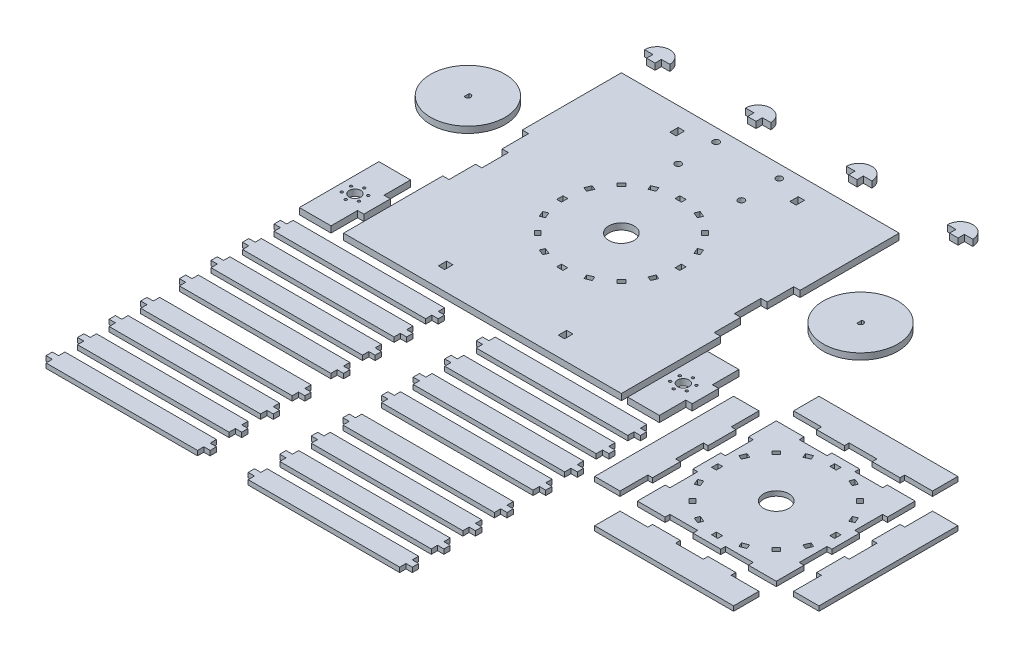
from build123d import *

# Parameters (mm, degrees)
SKETCH1_W              = 279.4
SKETCH1_H              = 279.4
BOSS_EXTRUDE1_DEPTH    = 6.35
SKETCH2_W              = 6.35
SKETCH2_H              = 80.00000002
CUT_EXTRUDE1_DEPTH     = 396.182290216
SKETCH3_R              = 37.5
BOSS_EXTRUDE2_DEPTH    = 6.35
SKETCH4_R              = 2.794
CUT_EXTRUDE3_DEPTH     = 6.35
SKETCH5_W              = 10
SKETCH5_H              = 10
BOSS_EXTRUDE4_DEPTH    = 6.35
BODY_MOVE_COPY1_ANGLE  = 90
SKETCH9_W              = 6.35
SKETCH9_H              = 80.00000002
BOSS_EXTRUDE5_DEPTH    = 31.841868752
SKETCH9_H_2            = 80
BOSS_EXTRUDE5_2_DEPTH  = 31.841868752
SKETCH10_R             = 5.842
CUT_EXTRUDE4_DEPTH     = 6.35
SKETCH11_R             = 1.27
CUT_EXTRUDE5_DEPTH     = 6.35
CIRPATTERN1_COUNT      = 6
SKETCH12_R             = 5.842
CUT_EXTRUDE6_DEPTH     = 6.35
SKETCH13_R             = 1.27
CUT_EXTRUDE7_DEPTH     = 6.35
CIRPATTERN2_COUNT      = 6
SKETCH14_W             = 6.35
SKETCH14_H             = 26.666666674
BOSS_EXTRUDE6_DEPTH    = 6.35
SKETCH15_W             = 6.35
SKETCH15_H             = 26.666666666
BOSS_EXTRUDE7_DEPTH    = 6.35
SKETCH18_W             = 26.666666674
SKETCH18_H             = 6.35
CUT_EXTRUDE8_DEPTH     = 6.35
SKETCH19_W             = 26.666666674
SKETCH19_H             = 6.35
CUT_EXTRUDE9_DEPTH     = 6.35
BODY_MOVE_COPY12_ANGLE = 90
BODY_MOVE_COPY13_ANGLE = 90
SKETCH23_R             = 3.175
CUT_EXTRUDE12_DEPTH    = 6.35
SKETCH24_R             = 12.7
BOSS_EXTRUDE11_DEPTH   = 6.35
SKETCH25_W             = 57.15
SKETCH25_H             = 55.515068024
CUT_EXTRUDE13_DEPTH    = 467.924067709
SKETCH26_W             = 8.466666667
SKETCH26_H             = 6.35
BOSS_EXTRUDE12_DEPTH   = 6.35
SKETCH27_W             = 6.35
SKETCH27_H             = 8.382
CUT_EXTRUDE14_DEPTH    = 467.924067709
SKETCH28_R             = 12.7
SKETCH28_W             = 6.35
SKETCH28_H             = 4.7625
CUT_EXTRUDE15_DEPTH    = 467.924067709
CIRPATTERN3_COUNT      = 16
SKETCH29_W             = 165.1
SKETCH29_H             = 19.05
BOSS_EXTRUDE14_DEPTH   = 4.7625
SKETCH30_W             = 6.35
SKETCH30_H             = 4.7625
CUT_EXTRUDE16_DEPTH    = 6.35
SKETCH31_W             = 6.35
SKETCH31_H             = 4.7625
CUT_EXTRUDE17_DEPTH    = 6.35
SKETCH32_W             = 139.7
SKETCH32_H             = 139.7
BOSS_EXTRUDE15_DEPTH   = 4.7625
SKETCH33_R             = 12.7
SKETCH33_W             = 6.35
SKETCH33_H             = 4.7625
CUT_EXTRUDE18_DEPTH    = 553.355903322
CIRPATTERN4_COUNT      = 16
SKETCH35_W             = 27.94
SKETCH35_H             = 4.7625
CUT_EXTRUDE19_DEPTH    = 4.7625
CIRPATTERN5_COUNT      = 4
SKETCH37_W             = 139.7
SKETCH37_H             = 30.226
BOSS_EXTRUDE16_DEPTH   = 4.7625
SKETCH38_W             = 27.94
SKETCH38_H             = 4.7625
CUT_EXTRUDE20_DEPTH    = 4.7625
CIRPATTERN8_COUNT      = 4


with BuildPart() as part:
    # Sketch1 → Boss-Extrude1 (new body)
    with BuildSketch(Plane(origin=(0, 0, 0), x_dir=(1, 0, 0), z_dir=(0, 1, 0))):
        with Locations((-139.7, -139.7)):
            Rectangle(SKETCH1_W, SKETCH1_H)
    extrude(amount=BOSS_EXTRUDE1_DEPTH)

    # Sketch2 → Cut-Extrude1 (cut, through all)
    with BuildSketch(Plane(origin=(0, 6.35, 0), x_dir=(1, 0, 0), z_dir=(0, 1, 0))):
        with Locations((-276.225, -139.7)):
            Rectangle(SKETCH2_W, SKETCH2_H)
        with Locations((-3.175, -139.7)):
            Rectangle(SKETCH2_W, SKETCH2_H)
    extrude(amount=-CUT_EXTRUDE1_DEPTH, mode=Mode.SUBTRACT)

    # Sketch18 → Cut-Extrude8 (cut)
    with BuildSketch(Plane(origin=(-6.35, 0, 0), x_dir=(0, 0, -1), z_dir=(1, 0, 0))):
        with Locations((-139.7, 3.175)):
            Rectangle(SKETCH18_W, SKETCH18_H)
    extrude(amount=-CUT_EXTRUDE8_DEPTH, mode=Mode.SUBTRACT)

    # Sketch19 → Cut-Extrude9 (cut)
    with BuildSketch(Plane.ZY.offset(273.05)):
        with Locations((139.7, 3.175)):
            Rectangle(SKETCH19_W, SKETCH19_H)
    extrude(amount=-CUT_EXTRUDE9_DEPTH, mode=Mode.SUBTRACT)

    # Sketch23 → Cut-Extrude12 (cut)
    with BuildSketch(Plane(origin=(0, 6.35, 0), x_dir=(1, 0, 0), z_dir=(0, 1, 0))):
        with Locations(Location((-171.45, -12.7, 0), (0, 0, 270))):
            Circle(SKETCH23_R)
        with Locations(Location((-171.45, -50.8, 0), (0, 0, 270))):
            Circle(SKETCH23_R)
        with Locations(Location((-107.95, -50.8, 0), (0, 0, 270))):
            Circle(SKETCH23_R)
        with Locations(Location((-107.95, -12.7, 0), (0, 0, 270))):
            Circle(SKETCH23_R)
    extrude(amount=-CUT_EXTRUDE12_DEPTH, mode=Mode.SUBTRACT)

    # Sketch27 → Cut-Extrude14 (cut, through all)
    with BuildSketch(Plane(origin=(0, 6.35, 0), x_dir=(1, 0, 0), z_dir=(0, 1, 0))):
        with Locations((-200.025, -23.241)):
            Rectangle(SKETCH27_W, SKETCH27_H)
        with Locations((-79.375, -23.241)):
            Rectangle(SKETCH27_W, SKETCH27_H)
        with Locations((-79.375, -256.159)):
            Rectangle(SKETCH27_W, SKETCH27_H)
        with Locations((-200.025, -256.159)):
            Rectangle(SKETCH27_W, SKETCH27_H)
    extrude(amount=-CUT_EXTRUDE14_DEPTH, mode=Mode.SUBTRACT)

    # Sketch28 → Cut-Extrude15 (cut, through all)
    with BuildSketch(Plane(origin=(0, 6.35, 0), x_dir=(1, 0, 0), z_dir=(0, 1, 0))):
        with Locations(Location((-139.7, -139.7, 0), (0, 0, 270))):
            Circle(SKETCH28_R)
        with Locations((-139.7, -199.23125)):
            Rectangle(SKETCH28_W, SKETCH28_H)
    cut_extrude15 = extrude(amount=-CUT_EXTRUDE15_DEPTH, mode=Mode.SUBTRACT)

    # CirPattern3: Cut-Extrude15 ×16 about axis
    cirpattern3_axis = Axis((-139.7, 0, 139.7), (0, 1, 0))
    for i in range(1, CIRPATTERN3_COUNT):
        add(cut_extrude15.rotate(cirpattern3_axis, i * 360 / CIRPATTERN3_COUNT), mode=Mode.SUBTRACT)


with BuildPart() as body_2:
    # Sketch3 → Boss-Extrude2 (new body)
    with BuildSketch(Plane(origin=(0, 0, 0), x_dir=(0, 0, -1), z_dir=(1, 0, 0))):
        with Locations((-97.251276482, 275.771880831)):
            Circle(SKETCH3_R)
    extrude(amount=BOSS_EXTRUDE2_DEPTH)

    # Sketch4 → Cut-Extrude3 (cut)
    with BuildSketch(Plane(origin=(6.35, 0, 0), x_dir=(0, 0, -1), z_dir=(1, 0, 0))):
        with Locations((-97.251276482, 275.771880831)):
            Circle(SKETCH4_R)
    extrude(amount=-CUT_EXTRUDE3_DEPTH, mode=Mode.SUBTRACT)

    # Sketch5 → Boss-Extrude4 (add)
    with BuildSketch(Plane(origin=(6.35, 0, 0), x_dir=(0, 0, -1), z_dir=(1, 0, 0))):
        with Locations((-99.898635716, 269.501880831)):
            Rectangle(SKETCH5_W, SKETCH5_H)
    extrude(amount=-BOSS_EXTRUDE4_DEPTH)


with BuildPart() as body_2_1:
    # Body-Move/Copy1: moved
    add(body_2.part.rotate(Axis((3.81, 275.771880831, 0), (0, 0, -1)), BODY_MOVE_COPY1_ANGLE))


with BuildPart() as body_2_2:
    # Body-Move/Copy3: read off the stored shape, not the designer's step
    # Body-Move/Copy3: moved
    add(body_2_1.part.moved(Location((54.61, -273.2318808, 0))))


with BuildPart() as body_3:
    # Body-Move/Copy4: copy of body 2
    add(body_2_2.part.moved(Location((-430, 0, 0))))


with BuildPart() as body_3_1:
    # Body-Move/Copy7: read off the stored shape, not the designer's step
    # Body-Move/Copy7: moved
    add(body_3.part.moved(Location((35.03, 0, 0))))


with BuildPart() as body_4:
    # Sketch9 → Boss-Extrude5 (new body)
    with BuildSketch(Plane(origin=(0, 6.35, 0), x_dir=(1, 0, 0), z_dir=(0, 1, 0))):
        with Locations((-269.875, -139.7)):
            Rectangle(SKETCH9_W, SKETCH9_H)
    extrude(amount=BOSS_EXTRUDE5_DEPTH)

    # Sketch10 → Cut-Extrude4 (cut)
    with BuildSketch(Plane.ZY.offset(273.05)):
        with Locations((139.7, 22.270934376)):
            Circle(SKETCH10_R)
    extrude(amount=-CUT_EXTRUDE4_DEPTH, mode=Mode.SUBTRACT)

    # Sketch11 → Cut-Extrude5 (cut)
    with BuildSketch(Plane.ZY.offset(273.05)):
        with Locations((130.05250812, 22.565899486)):
            Circle(SKETCH11_R)
    cut_extrude5 = extrude(amount=-CUT_EXTRUDE5_DEPTH, mode=Mode.SUBTRACT)

    # CirPattern1: Cut-Extrude5 ×6 about axis
    cirpattern1_axis = Axis((0, 22.270934376, 139.7), (1, 0, 0))
    for i in range(1, CIRPATTERN1_COUNT):
        add(cut_extrude5.rotate(cirpattern1_axis, i * 360 / CIRPATTERN1_COUNT), mode=Mode.SUBTRACT)


with BuildPart() as body_5:
    # Sketch9 → Boss-Extrude5 2 (new body)
    with BuildSketch(Plane(origin=(0, 6.35, 0), x_dir=(1, 0, 0), z_dir=(0, 1, 0))):
        with Locations((-9.525, -139.70000001)):
            Rectangle(SKETCH9_W, SKETCH9_H_2)
    extrude(amount=BOSS_EXTRUDE5_2_DEPTH)

    # Sketch12 → Cut-Extrude6 (cut)
    with BuildSketch(Plane(origin=(-6.35, 0, 0), x_dir=(0, 0, -1), z_dir=(1, 0, 0))):
        with Locations((-139.70000002, 22.270934376)):
            Circle(SKETCH12_R)
    extrude(amount=-CUT_EXTRUDE6_DEPTH, mode=Mode.SUBTRACT)

    # Sketch13 → Cut-Extrude7 (cut)
    with BuildSketch(Plane(origin=(-6.35, 0, 0), x_dir=(0, 0, -1), z_dir=(1, 0, 0))):
        with Locations((-149.35200002, 22.270934376)):
            Circle(SKETCH13_R)
    cut_extrude7 = extrude(amount=-CUT_EXTRUDE7_DEPTH, mode=Mode.SUBTRACT)

    # CirPattern2: Cut-Extrude7 ×6 about axis
    cirpattern2_axis = Axis((0, 22.270934376, 139.70000002), (1, 0, 0))
    for i in range(1, CIRPATTERN2_COUNT):
        add(cut_extrude7.rotate(cirpattern2_axis, i * 360 / CIRPATTERN2_COUNT), mode=Mode.SUBTRACT)


with BuildPart() as body_4_1:
    # Body-Move/Copy10: moved
    add(body_4.part.moved(Location((0, 50.8, 0))))

    # Sketch14 → Boss-Extrude6 (add)
    with BuildSketch(Plane(origin=(0, 57.15, 0), x_dir=(-1, 0, 0), z_dir=(0, -1, 0))):
        with Locations((269.875, -139.7)):
            Rectangle(SKETCH14_W, SKETCH14_H)
    extrude(amount=BOSS_EXTRUDE6_DEPTH)


with BuildPart() as body_5_1:
    # Body-Move/Copy10: moved
    add(body_5.part.moved(Location((0, 50.8, 0))))

    # Sketch15 → Boss-Extrude7 (add)
    with BuildSketch(Plane(origin=(0, 57.15, 0), x_dir=(-1, 0, 0), z_dir=(0, -1, 0))):
        with Locations((9.525, -139.70000001)):
            Rectangle(SKETCH15_W, SKETCH15_H)
    extrude(amount=BOSS_EXTRUDE7_DEPTH)


with BuildPart() as body_4_2:
    # Body-Move/Copy12: read off the stored shape, not the designer's step
    # Body-Move/Copy12: moved
    add(body_4_1.part.moved(Location((273.05, 234.95, 99.7))).rotate(Axis((0, 0, 0), (0, 0, 1)), BODY_MOVE_COPY12_ANGLE))


with BuildPart() as body_5_2:
    # Body-Move/Copy13: read off the stored shape, not the designer's step
    # Body-Move/Copy13: moved
    add(body_5_1.part.moved(Location((12.7, -95.3418688, 99.7))).rotate(Axis((0, 0, 0), (0, 0, 1)), BODY_MOVE_COPY13_ANGLE))


with BuildPart() as body_6:
    # Sketch24 → Boss-Extrude11 (new body)
    with BuildSketch(Plane(origin=(0, 0, 0), x_dir=(1, 0, 0), z_dir=(0, 1, 0))):
        with Locations(Location((-330.442968795, 66.703609718, 0), (0, 0, 270))):
            Circle(SKETCH24_R)
    extrude(amount=BOSS_EXTRUDE11_DEPTH)

    # Sketch25 → Cut-Extrude13 (cut, through all)
    with BuildSketch(Plane(origin=(0, 6.35, 0), x_dir=(1, 0, 0), z_dir=(0, 1, 0))):
        with Locations((-346.317968795, 38.946075706)):
            Rectangle(SKETCH25_W, SKETCH25_H)
    extrude(amount=-CUT_EXTRUDE13_DEPTH, mode=Mode.SUBTRACT)

    # Sketch26 → Boss-Extrude12 (add)
    with BuildSketch(Plane.XY.offset(-66.703609718)):
        with Locations((-330.442968795, 3.175)):
            Rectangle(SKETCH26_W, SKETCH26_H)
    extrude(amount=BOSS_EXTRUDE12_DEPTH)


with BuildPart() as body_6_1:
    # Body-Move/Copy14: read off the stored shape, not the designer's step
    # Body-Move/Copy14: moved
    add(body_6.part.moved(Location((55.2763021, 0, 34.9536097))))


with BuildPart() as body_7:
    # Body-Move/Copy15: copy of body 6
    add(body_6_1.part.moved(Location((101.6, 0, 0))))


with BuildPart() as body_8:
    # Body-Move/Copy16: copy of body 7
    add(body_7.part.moved(Location((101.6, 0, 0))))


with BuildPart() as body_9:
    # Body-Move/Copy17: copy of body 8
    add(body_8.part.moved(Location((101.6, 0, 0))))


with BuildPart() as body_10:
    # Sketch29 → Boss-Extrude14 (new body)
    with BuildSketch(Plane(origin=(0, 0, 0), x_dir=(1, 0, 0), z_dir=(0, 1, 0))):
        with Locations((-163.268990804, -364.473844535)):
            Rectangle(SKETCH29_W, SKETCH29_H)
    extrude(amount=BOSS_EXTRUDE14_DEPTH)

    # Sketch30 → Cut-Extrude16 (cut)
    with BuildSketch(Plane(origin=(-80.718990804, 0, 0), x_dir=(0, 0, -1), z_dir=(1, 0, 0))):
        with Locations((-370.823844535, 2.38125)):
            Rectangle(SKETCH30_W, SKETCH30_H)
        with Locations((-358.123844535, 2.38125)):
            Rectangle(SKETCH30_W, SKETCH30_H)
    extrude(amount=-CUT_EXTRUDE16_DEPTH, mode=Mode.SUBTRACT)

    # Sketch31 → Cut-Extrude17 (cut)
    with BuildSketch(Plane.ZY.offset(245.818990804)):
        with Locations((370.823844535, 2.38125)):
            Rectangle(SKETCH31_W, SKETCH31_H)
        with Locations((358.123844535, 2.38125)):
            Rectangle(SKETCH31_W, SKETCH31_H)
    extrude(amount=-CUT_EXTRUDE17_DEPTH, mode=Mode.SUBTRACT)


with BuildPart() as body_10_1:
    # Body-Move/Copy18: read off the stored shape, not the designer's step
    # Body-Move/Copy18: moved
    add(body_10.part.moved(Location((125.2608596, 0, -62.8488445))))


with BuildPart() as body_11:
    # Body-Move/Copy19: copy of body 10
    add(body_10_1.part.moved(Location((-182.495401927, 0, 0))))


with BuildPart() as body_11_1:
    # Body-Move/Copy20: read off the stored shape, not the designer's step
    # Body-Move/Copy20: moved
    add(body_11.part.moved(Location((-20.8883356, 0, 0))))


with BuildPart() as body_12:
    # Body-Move/Copy21: read off the stored shape, not the designer's step
    # Body-Move/Copy21: copy of body 11
    add(body_11_1.part.moved(Location((0, 0, 75.6060235))))


with BuildPart() as body_13:
    # Body-Move_Copy21 2: copy of body 11
    add(body_11_1.part.moved(Location((203.3837375, 0, 75.6060235))))


with BuildPart() as body_13_1:
    # Body-Move/Copy22: read off the stored shape, not the designer's step
    # Body-Move/Copy22: moved
    add(body_13.part.moved(Location((0, 0, -43.8560235))))


with BuildPart() as body_12_1:
    # Body-Move/Copy23: read off the stored shape, not the designer's step
    # Body-Move/Copy23: moved
    add(body_12.part.moved(Location((0, 0, -43.8560235))))


with BuildPart() as body_14:
    # Body-Move/Copy24: read off the stored shape, not the designer's step
    # Body-Move/Copy24: copy of body 12
    add(body_12_1.part.moved(Location((0, 0, 73.9515316))))


with BuildPart() as body_15:
    # Body-Move_Copy24 2: copy of body 12
    add(body_12_1.part.moved(Location((0, 0, 105.7015316))))


with BuildPart() as body_16:
    # Body-Move_Copy24 3: copy of body 12
    add(body_12_1.part.moved(Location((203.3837375, 0, 105.7015316))))


with BuildPart() as body_17:
    # Body-Move_Copy24 4: copy of body 12
    add(body_12_1.part.moved(Location((203.3837375, 0, 73.9515316))))


with BuildPart() as body_14_1:
    # Body-Move/Copy25: read off the stored shape, not the designer's step
    # Body-Move/Copy25: moved
    add(body_14.part.moved(Location((0, 0, -42.2015316))))


with BuildPart() as body_17_1:
    # Body-Move_Copy25 2: moved
    add(body_17.part.moved(Location((0, 0, -42.2015316))))


with BuildPart() as body_15_1:
    # Body-Move/Copy26: read off the stored shape, not the designer's step
    # Body-Move/Copy26: moved
    add(body_15.part.moved(Location((0, 0, -42.2015316))))


with BuildPart() as body_16_1:
    # Body-Move_Copy26 2: moved
    add(body_16.part.moved(Location((0, 0, -42.2015316))))


with BuildPart() as body_18:
    # Sketch32 → Boss-Extrude15 (new body)
    with BuildSketch(Plane(origin=(0, 0, 0), x_dir=(1, 0, 0), z_dir=(0, 1, 0))):
        with Locations((206.821592054, -219.287970599)):
            Rectangle(SKETCH32_W, SKETCH32_H)
    extrude(amount=BOSS_EXTRUDE15_DEPTH)

    # Sketch33 → Cut-Extrude18 (cut, through all)
    with BuildSketch(Plane(origin=(0, 4.7625, 0), x_dir=(1, 0, 0), z_dir=(0, 1, 0))):
        with Locations(Location((206.821592054, -219.287970599, 0), (0, 0, 270))):
            Circle(SKETCH33_R)
        with Locations((206.821592054, -278.819220599)):
            Rectangle(SKETCH33_W, SKETCH33_H)
    cut_extrude18 = extrude(amount=-CUT_EXTRUDE18_DEPTH, mode=Mode.SUBTRACT)

    # CirPattern4: Cut-Extrude18 ×16 about axis
    cirpattern4_axis = Axis((206.821592054, 0, 219.287970599), (0, 1, 0))
    for i in range(1, CIRPATTERN4_COUNT):
        add(cut_extrude18.rotate(cirpattern4_axis, i * 360 / CIRPATTERN4_COUNT), mode=Mode.SUBTRACT)

    # Sketch35 → Cut-Extrude19 (cut)
    with BuildSketch(Plane(origin=(276.671592054, 0, 0), x_dir=(0, 0, -1), z_dir=(1, 0, 0))):
        with Locations((-191.347970599, 2.38125)):
            Rectangle(SKETCH35_W, SKETCH35_H)
        with Locations((-247.227970599, 2.38125)):
            Rectangle(SKETCH35_W, SKETCH35_H)
    cut_extrude19 = extrude(amount=-CUT_EXTRUDE19_DEPTH, mode=Mode.SUBTRACT)

    # CirPattern5: Cut-Extrude19 ×4 about axis
    cirpattern5_axis = Axis((206.821592054, 0, 219.287970599), (0, 1, 0))
    for i in range(1, CIRPATTERN5_COUNT):
        add(cut_extrude19.rotate(cirpattern5_axis, i * 360 / CIRPATTERN5_COUNT), mode=Mode.SUBTRACT)


with BuildPart() as body_19:
    # Sketch37 → Boss-Extrude16 (new body)
    with BuildSketch(Plane(origin=(0, 0, 0), x_dir=(1, 0, 0), z_dir=(0, 1, 0))):
        with Locations((163.005326328, -7.580285878)):
            Rectangle(SKETCH37_W, SKETCH37_H)
    extrude(amount=BOSS_EXTRUDE16_DEPTH)

    # Sketch38 → Cut-Extrude20 (cut)
    with BuildSketch(Plane.XY.offset(22.693285878)):
        with Locations((218.885326328, 2.38125)):
            Rectangle(SKETCH38_W, SKETCH38_H)
        with Locations((163.005326328, 2.38125)):
            Rectangle(SKETCH38_W, SKETCH38_H)
        with Locations((107.125326328, 2.38125)):
            Rectangle(SKETCH38_W, SKETCH38_H)
    extrude(amount=-CUT_EXTRUDE20_DEPTH, mode=Mode.SUBTRACT)


with BuildPart() as body_19_1:
    # Body-Move/Copy27: read off the stored shape, not the designer's step
    # Body-Move/Copy27: moved
    add(body_19.part.moved(Location((43.8162657, 0, 114.0446847))))


with BuildPart() as cirpattern8_1:
    # CirPattern8: pattern copy
    add(body_19_1.part.rotate(Axis((206.821592054, 0, 219.287970599), (0, 1, 0)), 1 * 360 / CIRPATTERN8_COUNT))


with BuildPart() as cirpattern8_2:
    # CirPattern8: pattern copy
    add(body_19_1.part.rotate(Axis((206.821592054, 0, 219.287970599), (0, 1, 0)), 2 * 360 / CIRPATTERN8_COUNT))


with BuildPart() as cirpattern8_3:
    # CirPattern8: pattern copy
    add(body_19_1.part.rotate(Axis((206.821592054, 0, 219.287970599), (0, 1, 0)), 3 * 360 / CIRPATTERN8_COUNT))


with BuildPart() as cirpattern8_1_1:
    # Body-Move/Copy28: read off the stored shape, not the designer's step
    # Body-Move/Copy28: moved
    add(cirpattern8_1.part.moved(Location((-36.8037233, 0, 74.3360294))))


with BuildPart() as cirpattern8_2_1:
    # Body-Move_Copy28 2: moved
    add(cirpattern8_2.part.moved(Location((-36.8037233, 0, 74.3360294))))


with BuildPart() as cirpattern8_3_1:
    # Body-Move_Copy28 3: moved
    add(cirpattern8_3.part.moved(Location((-36.8037233, 0, 74.3360294))))


with BuildPart() as body_19_2:
    # Body-Move_Copy28 4: moved
    add(body_19_1.part.moved(Location((-36.8037233, 0, 74.3360294))))


with BuildPart() as body_18_1:
    # Body-Move_Copy28 5: moved
    add(body_18.part.moved(Location((-36.8037233, 0, 74.3360294))))


with BuildPart() as body_23:
    # Body-Move/Copy29: read off the stored shape, not the designer's step
    # Body-Move/Copy29: copy of body 14
    add(body_14_1.part.moved(Location((203.3837375, 0, 134.1979353))))


with BuildPart() as body_24:
    # Body-Move_Copy29 2: copy of body 14
    add(body_14_1.part.moved(Location((0, 0, 70.6979353))))


with BuildPart() as body_25:
    # Body-Move_Copy29 3: copy of body 14
    add(body_14_1.part.moved(Location((0, 0, 102.4479353))))


with BuildPart() as body_26:
    # Body-Move_Copy29 4: copy of body 14
    add(body_14_1.part.moved(Location((0, 0, 134.1979353))))


with BuildPart() as body_27:
    # Body-Move_Copy29 5: copy of body 14
    add(body_14_1.part.moved(Location((0, 0, 165.9479353))))


with BuildPart() as body_28:
    # Body-Move_Copy29 6: copy of body 14
    add(body_14_1.part.moved(Location((203.3837375, 0, 165.9479353))))


with BuildPart() as body_29:
    # Body-Move_Copy29 7: copy of body 14
    add(body_14_1.part.moved(Location((203.3837375, 0, 102.4479353))))


with BuildPart() as body_30:
    # Body-Move_Copy29 8: copy of body 14
    add(body_14_1.part.moved(Location((203.3837375, 0, 70.6979353))))


solid = Compound([part.part, body_2_2.part, body_3_1.part, body_4_2.part, body_5_2.part, body_6_1.part, body_7.part, body_8.part, body_9.part, body_10_1.part, body_11_1.part, body_13_1.part, body_12_1.part, body_14_1.part, body_17_1.part, body_15_1.part, body_16_1.part, cirpattern8_1_1.part, cirpattern8_2_1.part, cirpattern8_3_1.part, body_19_2.part, body_18_1.part, body_23.part, body_24.part, body_25.part, body_26.part, body_27.part, body_28.part, body_29.part, body_30.part])
